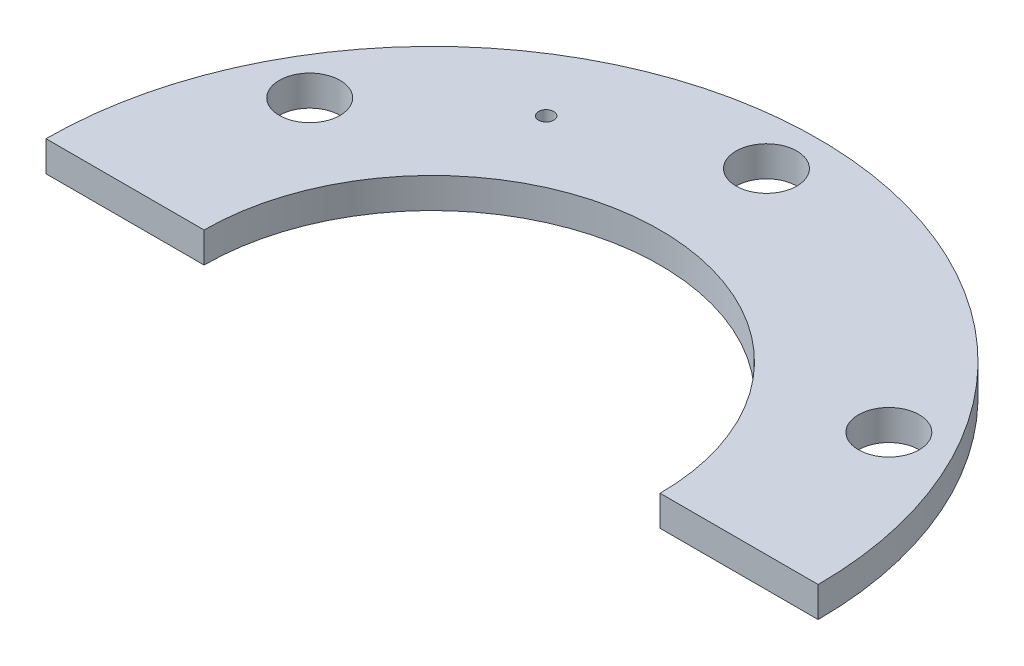
from build123d import *

# Parameters (mm, degrees)
SKETCH1_R               = 12.7
BOSS_EXTRUDE1_DEPTH     = 1
CUT_EXTRUDE1_DEPTH      = 18.98832955
CUT_EXTRUDE1_DEPTH_BACK = 18.98832955
SKETCH19_R              = 1
CUT_EXTRUDE2_DEPTH      = 18.98832955
CUT_EXTRUDE2_DEPTH_BACK = 18.98832955
SKETCH20_R              = 7.5
SKETCH21_W              = 65.874202484
SKETCH21_H              = 51.979273979
CUT_EXTRUDE3_DEPTH      = 18.98832955
CUT_EXTRUDE4_DEPTH      = 18.98832955
CUT_EXTRUDE4_DEPTH_BACK = 18.98832955
SKETCH22_R              = 0.25


with BuildPart() as part:
    # Sketch1 → Boss-Extrude1 (new body)
    with BuildSketch(Plane(origin=(0, 0, 0), x_dir=(1, 0, 0), z_dir=(0, 1, 0))):
        Circle(SKETCH1_R)
    extrude(amount=BOSS_EXTRUDE1_DEPTH)

    # Sketch19 → Cut-Extrude1 (cut, two sides: drawn at the far end of the back side and taken through both)
    with BuildSketch(Plane(origin=(0, 1, 0), x_dir=(1, 0, 0), z_dir=(0, 1, 0)).offset(-CUT_EXTRUDE1_DEPTH_BACK)):
        with Locations((0, 11)):
            Circle(SKETCH19_R)
        with Locations((9.526279442, 5.5)):
            Circle(SKETCH19_R)
        with Locations((9.526279442, -5.5)):
            Circle(SKETCH19_R)
        with Locations((0, -11)):
            Circle(SKETCH19_R)
        with Locations((-9.526279442, -5.5)):
            Circle(SKETCH19_R)
        with Locations((-9.526279442, 5.5)):
            Circle(SKETCH19_R)
    extrude(amount=CUT_EXTRUDE1_DEPTH + CUT_EXTRUDE1_DEPTH_BACK, mode=Mode.SUBTRACT)

    # Sketch20 → Cut-Extrude2 (cut, two sides: drawn at the far end of the back side and taken through both)
    with BuildSketch(Plane(origin=(0, 1, 0), x_dir=(1, 0, 0), z_dir=(0, 1, 0)).offset(-CUT_EXTRUDE2_DEPTH_BACK)):
        Circle(SKETCH20_R)
    extrude(amount=CUT_EXTRUDE2_DEPTH + CUT_EXTRUDE2_DEPTH_BACK, mode=Mode.SUBTRACT)

    # Sketch21 → Cut-Extrude3 (cut, through all)
    with BuildSketch(Plane.XY):
        with Locations((-3.816154381, 6.321647006)):
            Rectangle(SKETCH21_W, SKETCH21_H)
    extrude(amount=CUT_EXTRUDE3_DEPTH, mode=Mode.SUBTRACT)

    # Sketch22 → Cut-Extrude4 (cut, two sides: drawn at the far end of the back side and taken through both)
    with BuildSketch(Plane(origin=(0, 1, 0), x_dir=(1, 0, 0), z_dir=(0, 1, 0)).offset(-CUT_EXTRUDE4_DEPTH_BACK)):
        with Locations((-5.125, 8.876760389)):
            Circle(SKETCH22_R)
    extrude(amount=CUT_EXTRUDE4_DEPTH + CUT_EXTRUDE4_DEPTH_BACK, mode=Mode.SUBTRACT)


solid = part.part
